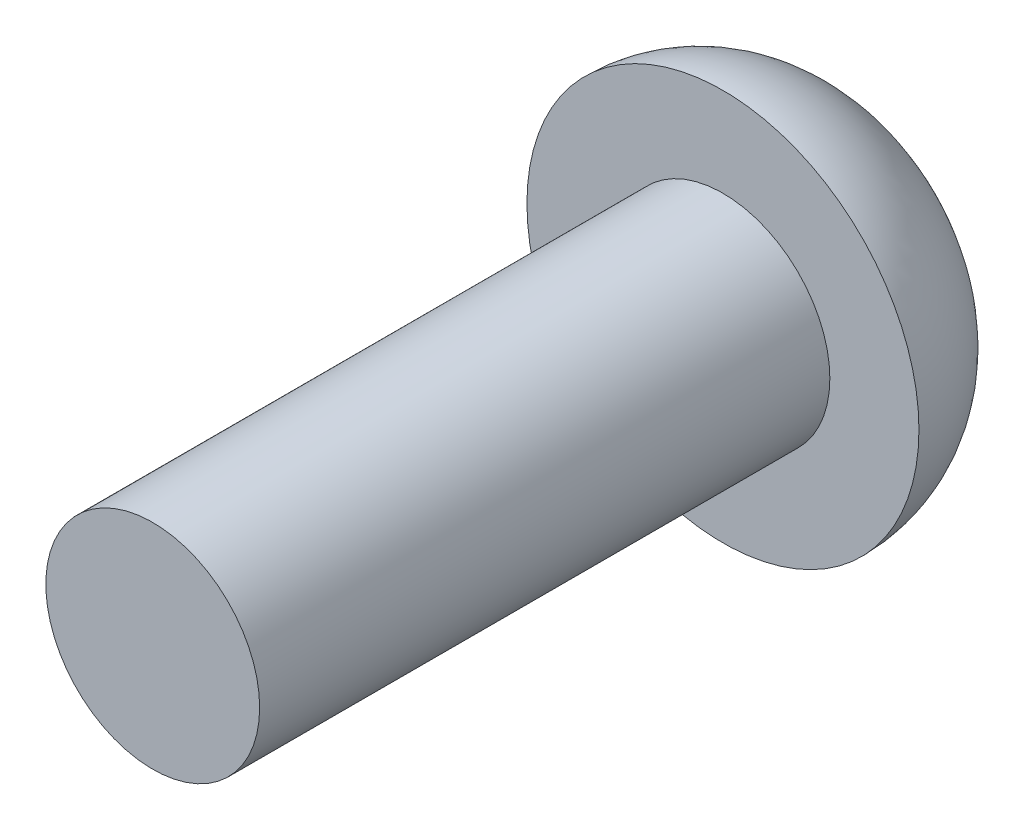
from build123d import *

# Parameters (mm, degrees)
SKETCH_1_R          = 2.75
EXTRUDE_1_DEPTH     = 2
SKETCH_2_R          = 1.5
EXTRUDE_2_DEPTH     = 8
FILLET_2_R          = 2
SKETCH_3_W          = 1
SKETCH_3_H          = 1
CUT_EXTRUDE_1_DEPTH = 1


with BuildPart() as part:
    # ｽｹｯﾁ1 → ﾎﾞｽ - 押し出し1 (new body)
    with BuildSketch(Plane.XY):
        Circle(SKETCH_1_R)
    extrude(amount=EXTRUDE_1_DEPTH)

    # ｽｹｯﾁ2 → ﾎﾞｽ - 押し出し2 (add)
    with BuildSketch(Plane.XY.offset(2)):
        Circle(SKETCH_2_R)
    extrude(amount=EXTRUDE_2_DEPTH)

    # ﾌｨﾚｯﾄ2
    fillet_2_edges = [part.edges().sort_by_distance(p)[0] for p in [
        (-2.75, 0, 0),
    ]]
    fillet(fillet_2_edges, radius=FILLET_2_R - 0.0001)  # a hair under: the kernel refuses the full size

    # ｽｹｯﾁ3 → ｶｯﾄ - 押し出し1 (cut)
    with BuildSketch(Plane(origin=(0, 0, 0), x_dir=(-1, 0, 0), z_dir=(0, 0, -1))):
        with BuildLine():
            Line((-0.5, 1.5), (-0.5, 0.559016994))
            ThreePointArc((-0.5, 0.559016994), (0, 0.75), (0.5, 0.559016994))
            Line((0.5, 0.559016994), (0.5, 1.5))
            Line((0.5, 1.5), (-0.5, 1.5))
        make_face()
        Rectangle(SKETCH_3_W, SKETCH_3_H)
        with BuildLine():
            ThreePointArc((0.75, 0), (0.700629269, -0.267616567), (0.559016994, -0.5))
            Line((0.559016994, -0.5), (1.5, -0.5))
            Line((1.5, -0.5), (1.5, 0.5))
            Line((1.5, 0.5), (0.559016994, 0.5))
            ThreePointArc((0.559016994, 0.5), (0.700629269, 0.267616567), (0.75, 0))
        make_face()
        with BuildLine():
            Line((0.5, 0.5), (0.5, -0.5))
            Line((0.5, -0.5), (0.559016994, -0.5))
            ThreePointArc((0.559016994, -0.5), (0.700629269, -0.267616567), (0.75, 0))
            ThreePointArc((0.75, 0), (0.700629269, 0.267616567), (0.559016994, 0.5))
            Line((0.559016994, 0.5), (0.5, 0.5))
        make_face()
        with BuildLine():
            ThreePointArc((-0.559016994, 0.5), (-0.75, 0), (-0.559016994, -0.5))
            Line((-0.559016994, -0.5), (-0.5, -0.5))
            Line((-0.5, -0.5), (-0.5, 0.5))
            Line((-0.5, 0.5), (-0.559016994, 0.5))
        make_face()
        with BuildLine():
            Line((-1.5, 0.5), (-1.5, -0.5))
            Line((-1.5, -0.5), (-0.559016994, -0.5))
            ThreePointArc((-0.559016994, -0.5), (-0.75, 0), (-0.559016994, 0.5))
            Line((-0.559016994, 0.5), (-1.5, 0.5))
        make_face()
        with BuildLine():
            Line((0.5, -0.5), (-0.5, -0.5))
            Line((-0.5, -0.5), (-0.5, -0.559016994))
            ThreePointArc((-0.5, -0.559016994), (0, -0.75), (0.5, -0.559016994))
            Line((0.5, -0.559016994), (0.5, -0.5))
        make_face()
        with BuildLine():
            ThreePointArc((0.5, -0.559016994), (0, -0.75), (-0.5, -0.559016994))
            Line((-0.5, -0.559016994), (-0.5, -1.5))
            Line((-0.5, -1.5), (0.5, -1.5))
            Line((0.5, -1.5), (0.5, -0.559016994))
        make_face()
        with BuildLine():
            Line((-0.5, 0.559016994), (-0.5, 0.5))
            Line((-0.5, 0.5), (0.5, 0.5))
            Line((0.5, 0.5), (0.5, 0.559016994))
            ThreePointArc((0.5, 0.559016994), (0, 0.75), (-0.5, 0.559016994))
        make_face()
    extrude(amount=-CUT_EXTRUDE_1_DEPTH, mode=Mode.SUBTRACT)


solid = part.part
